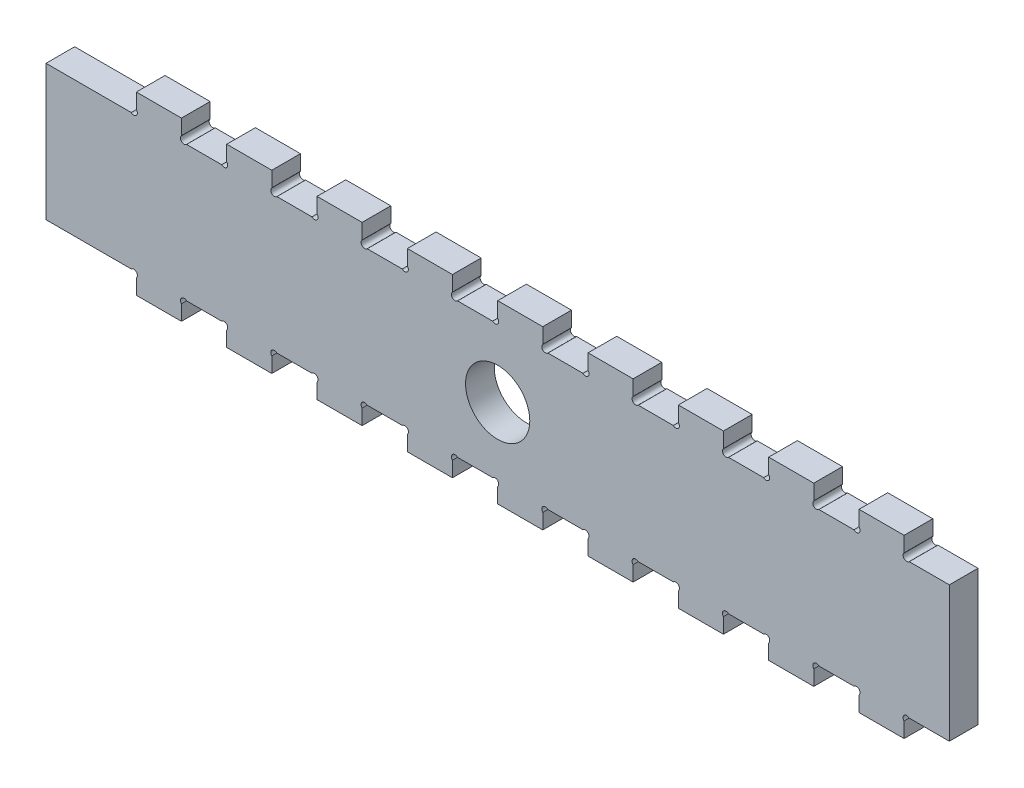
from build123d import *

# Parameters (mm, degrees)
BOSS_EXTRUDE1_DEPTH = 6.35
SKETCH1_R           = 7.112
CUT_EXTRUDE1_DEPTH  = 6.35
SKETCH2_W           = 10.0254
SKETCH2_H           = 4.477133961
CUT_EXTRUDE2_DEPTH  = 204.051450213
LPATTERN1_COUNT     = 9
LPATTERN1_PITCH     = 20
SKETCH5_R           = 0.79375
CUT_EXTRUDE4_DEPTH  = 3.175
LPATTERN2_COUNT     = 3
LPATTERN2_PITCH     = 2.032


# Read off the part's stored shape, not the designer's step: Boss-Extrude1
with BuildPart() as part:
    # Boss-Extrude1 outline → Boss-Extrude1 (new body)
    with BuildSketch(Plane.XY):
        with BuildLine():
            Line((190, -4.490128061), (190, -1.122532015))
            ThreePointArc((190, -1.122532015), (190, 0), (191.122532015, 0))
            Line((191.122532015, 0), (200, 0))
            Line((200, 0), (200, 30))
            Line((200, 30), (191.122532015, 30))
            ThreePointArc((191.122532015, 30), (190, 30), (190, 31.122532015))
            Line((190, 31.122532015), (190, 34.490128061))
            Line((190, 34.490128061), (180, 34.490128061))
            Line((180, 34.490128061), (180, 31.122532015))
            ThreePointArc((180, 31.122532015), (180, 30), (178.877467985, 30))
            Line((178.877467985, 30), (171.122532015, 30))
            ThreePointArc((171.122532015, 30), (170, 30), (170, 31.122532015))
            Line((170, 31.122532015), (170, 34.490128061))
            Line((170, 34.490128061), (160, 34.490128061))
            Line((160, 34.490128061), (160, 31.122532015))
            ThreePointArc((160, 31.122532015), (160, 30), (158.877467985, 30))
            Line((158.877467985, 30), (151.122532015, 30))
            ThreePointArc((151.122532015, 30), (150, 30), (150, 31.122532015))
            Line((150, 31.122532015), (150, 34.490128061))
            Line((150, 34.490128061), (140, 34.490128061))
            Line((140, 34.490128061), (140, 31.122532015))
            ThreePointArc((140, 31.122532015), (140, 30), (138.877467985, 30))
            Line((138.877467985, 30), (131.122532015, 30))
            ThreePointArc((131.122532015, 30), (130, 30), (130, 31.122532015))
            Line((130, 31.122532015), (130, 34.490128061))
            Line((130, 34.490128061), (120, 34.490128061))
            Line((120, 34.490128061), (120, 31.122532015))
            ThreePointArc((120, 31.122532015), (120, 30), (118.877467985, 30))
            Line((118.877467985, 30), (111.122532015, 30))
            ThreePointArc((111.122532015, 30), (110, 30), (110, 31.122532015))
            Line((110, 31.122532015), (110, 34.490128061))
            Line((110, 34.490128061), (100, 34.490128061))
            Line((100, 34.490128061), (100, 31.122532015))
            ThreePointArc((100, 31.122532015), (100, 30), (98.877467985, 30))
            Line((98.877467985, 30), (91.122532015, 30))
            ThreePointArc((91.122532015, 30), (90, 30), (90, 31.122532015))
            Line((90, 31.122532015), (90, 34.490128061))
            Line((90, 34.490128061), (80, 34.490128061))
            Line((80, 34.490128061), (80, 31.122532015))
            ThreePointArc((80, 31.122532015), (80, 30), (78.877467985, 30))
            Line((78.877467985, 30), (71.122532015, 30))
            ThreePointArc((71.122532015, 30), (70, 30), (70, 31.122532015))
            Line((70, 31.122532015), (70, 34.490128061))
            Line((70, 34.490128061), (60, 34.490128061))
            Line((60, 34.490128061), (60, 31.122532015))
            ThreePointArc((60, 31.122532015), (60, 30), (58.877467985, 30))
            Line((58.877467985, 30), (51.122532015, 30))
            ThreePointArc((51.122532015, 30), (50, 30), (50, 31.122532015))
            Line((50, 31.122532015), (50, 34.490128061))
            Line((50, 34.490128061), (40, 34.490128061))
            Line((40, 34.490128061), (40, 31.122532015))
            ThreePointArc((40, 31.122532015), (40, 30), (38.877467985, 30))
            Line((38.877467985, 30), (31.122532015, 30))
            ThreePointArc((31.122532015, 30), (30, 30), (30, 31.122532015))
            Line((30, 31.122532015), (30, 34.490128061))
            Line((30, 34.490128061), (20, 34.490128061))
            Line((20, 34.490128061), (20, 31.122532015))
            ThreePointArc((20, 31.122532015), (20, 30), (18.877467985, 30))
            Line((18.877467985, 30), (0, 30))
            Line((0, 30), (0, 0))
            Line((0, 0), (18.877467985, 0))
            ThreePointArc((18.877467985, 0), (20, 0), (20, -1.122532015))
            Line((20, -1.122532015), (20, -4.490128061))
            Line((20, -4.490128061), (30, -4.490128061))
            Line((30, -4.490128061), (30, -1.122532015))
            ThreePointArc((30, -1.122532015), (30, 0), (31.122532015, 0))
            Line((31.122532015, 0), (38.877467985, 0))
            ThreePointArc((38.877467985, 0), (40, 0), (40, -1.122532015))
            Line((40, -1.122532015), (40, -4.490128061))
            Line((40, -4.490128061), (50, -4.490128061))
            Line((50, -4.490128061), (50, -1.122532015))
            ThreePointArc((50, -1.122532015), (50, 0), (51.122532015, 0))
            Line((51.122532015, 0), (58.877467985, 0))
            ThreePointArc((58.877467985, 0), (60, 0), (60, -1.122532015))
            Line((60, -1.122532015), (60, -4.490128061))
            Line((60, -4.490128061), (70, -4.490128061))
            Line((70, -4.490128061), (70, -1.122532015))
            ThreePointArc((70, -1.122532015), (70, 0), (71.122532015, 0))
            Line((71.122532015, 0), (78.877467985, 0))
            ThreePointArc((78.877467985, 0), (80, 0), (80, -1.122532015))
            Line((80, -1.122532015), (80, -4.490128061))
            Line((80, -4.490128061), (90, -4.490128061))
            Line((90, -4.490128061), (90, -1.122532015))
            ThreePointArc((90, -1.122532015), (90, 0), (91.122532015, 0))
            Line((91.122532015, 0), (98.877467985, 0))
            ThreePointArc((98.877467985, 0), (100, 0), (100, -1.122532015))
            Line((100, -1.122532015), (100, -4.490128061))
            Line((100, -4.490128061), (110, -4.490128061))
            Line((110, -4.490128061), (110, -1.122532015))
            ThreePointArc((110, -1.122532015), (110, 0), (111.122532015, 0))
            Line((111.122532015, 0), (118.877467985, 0))
            ThreePointArc((118.877467985, 0), (120, 0), (120, -1.122532015))
            Line((120, -1.122532015), (120, -4.490128061))
            Line((120, -4.490128061), (130, -4.490128061))
            Line((130, -4.490128061), (130, -1.122532015))
            ThreePointArc((130, -1.122532015), (130, 0), (131.122532015, 0))
            Line((131.122532015, 0), (138.877467985, 0))
            ThreePointArc((138.877467985, 0), (140, 0), (140, -1.122532015))
            Line((140, -1.122532015), (140, -4.490128061))
            Line((140, -4.490128061), (150, -4.490128061))
            Line((150, -4.490128061), (150, -1.122532015))
            ThreePointArc((150, -1.122532015), (150, 0), (151.122532015, 0))
            Line((151.122532015, 0), (158.877467985, 0))
            ThreePointArc((158.877467985, 0), (160, 0), (160, -1.122532015))
            Line((160, -1.122532015), (160, -4.490128061))
            Line((160, -4.490128061), (170, -4.490128061))
            Line((170, -4.490128061), (170, -1.122532015))
            ThreePointArc((170, -1.122532015), (170, 0), (171.122532015, 0))
            Line((171.122532015, 0), (178.877467985, 0))
            ThreePointArc((178.877467985, 0), (180, 0), (180, -1.122532015))
            Line((180, -1.122532015), (180, -4.490128061))
            Line((180, -4.490128061), (190, -4.490128061))
        make_face()
    extrude(amount=BOSS_EXTRUDE1_DEPTH)

    # Sketch1 → Cut-Extrude1 (cut)
    with BuildSketch(Plane.XY.offset(6.35)):
        with Locations((100, 15)):
            Circle(SKETCH1_R)
    extrude(amount=-CUT_EXTRUDE1_DEPTH, mode=Mode.SUBTRACT)

    # Sketch2 → Cut-Extrude2 (cut, through all)
    with BuildSketch(Plane(origin=(0, 0, 0), x_dir=(-1, 0, 0), z_dir=(0, 0, -1))):
        with Locations((-35, 32.25156108)):
            Rectangle(SKETCH2_W, SKETCH2_H)
        with Locations((-35, -2.251561081)):
            Rectangle(SKETCH2_W, SKETCH2_H)
    cut_extrude2 = extrude(amount=-CUT_EXTRUDE2_DEPTH, mode=Mode.SUBTRACT)

    # LPattern1: Cut-Extrude2 ×9
    with Locations(*[(i * LPATTERN1_PITCH, 0, 0) for i in range(1, LPATTERN1_COUNT)]):
        add(cut_extrude2, mode=Mode.SUBTRACT)

    # Sketch5 → Cut-Extrude4 (cut)
    with BuildSketch(Plane(origin=(0, 0, 0), x_dir=(-1, 0, 0), z_dir=(0, 0, -1))):
        with Locations((-2.032, 2.032)):
            Circle(SKETCH5_R)
    cut_extrude4 = extrude(amount=-CUT_EXTRUDE4_DEPTH, mode=Mode.SUBTRACT)

    # LPattern2: Cut-Extrude4 ×3
    with Locations(*[(0, i * LPATTERN2_PITCH, 0) for i in range(1, LPATTERN2_COUNT)]):
        add(cut_extrude4, mode=Mode.SUBTRACT)


solid = part.part
